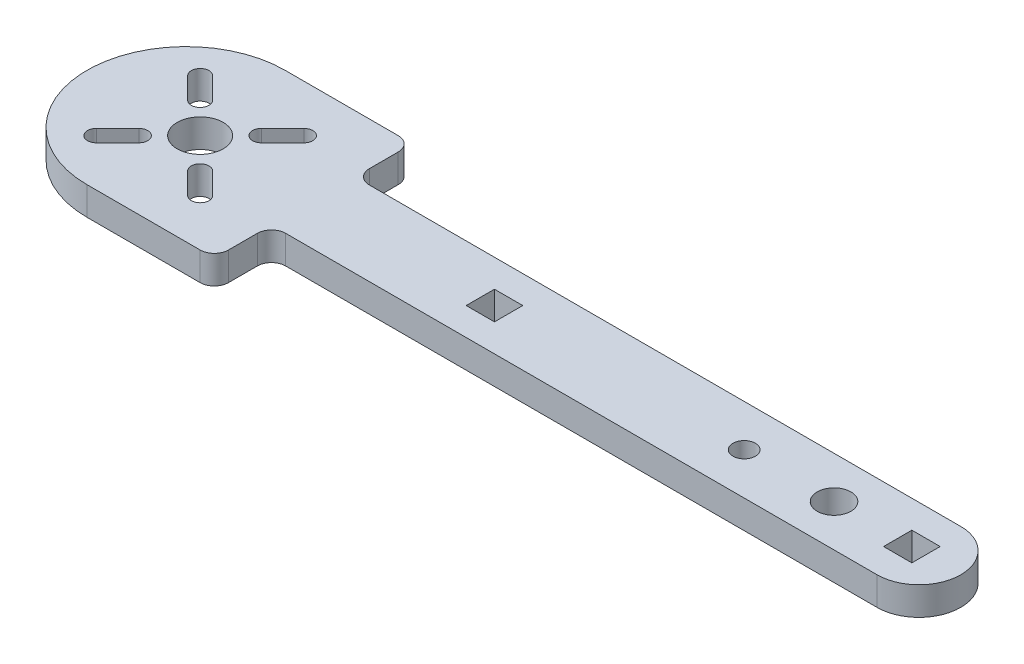
from build123d import *

# Parameters (mm, degrees)
SKETCH1_R           = 3.25
SKETCH1_W           = 4
SKETCH1_H           = 4
SKETCH1_R_2         = 2.38125
SKETCH1_R_3         = 1.5875
BOSS_EXTRUDE1_DEPTH = 4
SKETCH1_3_R         = 2.3749
CUT_EXTRUDE1_DEPTH  = 0.8128


with BuildPart() as part:
    # Sketch1 → Boss-Extrude1 (new body)
    with BuildSketch(Plane(origin=(0, 0, 0), x_dir=(1, 0, 0), z_dir=(0, 1, 0))):
        with BuildLine():
            Line((-36.8, 14), (-52.8, 14))
            ThreePointArc((-52.8, 14), (-66.8, 0), (-52.8, -14))
            Line((-52.8, -14), (-36.8, -14))
            ThreePointArc((-36.8, -14), (-35.385786438, -13.414213562), (-34.8, -12))
            Line((-34.8, -12), (-34.8, -7.914556152))
            ThreePointArc((-34.8, -7.914556152), (-34.214213562, -6.500342589), (-32.8, -5.914556152))
            Line((-32.8, -5.914556152), (50.8, -5.914556152))
            ThreePointArc((50.8, -5.914556152), (56.714556152, 0), (50.8, 5.914556152))
            Line((50.8, 5.914556152), (-32.8, 5.914556152))
            ThreePointArc((-32.8, 5.914556152), (-34.214213562, 6.500342589), (-34.8, 7.914556152))
            Line((-34.8, 7.914556152), (-34.8, 12))
            ThreePointArc((-34.8, 12), (-35.385786438, 13.414213562), (-36.8, 14))
        make_face()
        with BuildLine():
            ThreePointArc((-57.252349378, -8.220116331), (-59.020116331, -8.220116331), (-59.020116331, -6.452349378))
            Line((-59.020116331, -6.452349378), (-56.014912511, -3.447145558))
            ThreePointArc((-56.014912511, -3.447145558), (-54.247145558, -3.447145558), (-54.247145558, -5.214912511))
            Line((-54.247145558, -5.214912511), (-57.252349378, -8.220116331))
        make_face(mode=Mode.SUBTRACT)
        with BuildLine():
            ThreePointArc((-42.579883669, -6.452349378), (-42.579883669, -8.220116331), (-44.347650622, -8.220116331))
            Line((-44.347650622, -8.220116331), (-47.352854442, -5.214912511))
            ThreePointArc((-47.352854442, -5.214912511), (-47.352854442, -3.447145558), (-45.585087489, -3.447145558))
            Line((-45.585087489, -3.447145558), (-42.579883669, -6.452349378))
        make_face(mode=Mode.SUBTRACT)
        with Locations((-50.8, 0)):
            Circle(SKETCH1_R, mode=Mode.SUBTRACT)
        with BuildLine():
            ThreePointArc((-59.020116331, 6.452349378), (-59.020116331, 8.220116331), (-57.252349378, 8.220116331))
            Line((-57.252349378, 8.220116331), (-54.247145558, 5.214912511))
            ThreePointArc((-54.247145558, 5.214912511), (-54.247145558, 3.447145558), (-56.014912511, 3.447145558))
            Line((-56.014912511, 3.447145558), (-59.020116331, 6.452349378))
        make_face(mode=Mode.SUBTRACT)
        with BuildLine():
            ThreePointArc((-44.347650622, 8.220116331), (-42.579883669, 8.220116331), (-42.579883669, 6.452349378))
            Line((-42.579883669, 6.452349378), (-45.585087489, 3.447145558))
            ThreePointArc((-45.585087489, 3.447145558), (-47.352854442, 3.447145558), (-47.352854442, 5.214912511))
            Line((-47.352854442, 5.214912511), (-44.347650622, 8.220116331))
        make_face(mode=Mode.SUBTRACT)
        with Locations((-9.2, 0)):
            Rectangle(SKETCH1_W, SKETCH1_H, mode=Mode.SUBTRACT)
        with Locations((38.8, 0)):
            Circle(SKETCH1_R_2, mode=Mode.SUBTRACT)
        with Locations((49.8, 0)):
            Rectangle(SKETCH1_W, SKETCH1_H, mode=Mode.SUBTRACT)
        with Locations((26.1, 0)):
            Circle(SKETCH1_R_3, mode=Mode.SUBTRACT)
    extrude(amount=BOSS_EXTRUDE1_DEPTH)

    # Sketch1<3> → Cut-Extrude1 (cut)
    with BuildSketch(Plane(origin=(0, 0, 0), x_dir=(1, 0, 0), z_dir=(0, 1, 0))):
        with Locations((26.1, 0)):
            Circle(SKETCH1_3_R)
    extrude(amount=CUT_EXTRUDE1_DEPTH, mode=Mode.SUBTRACT)


solid = part.part
